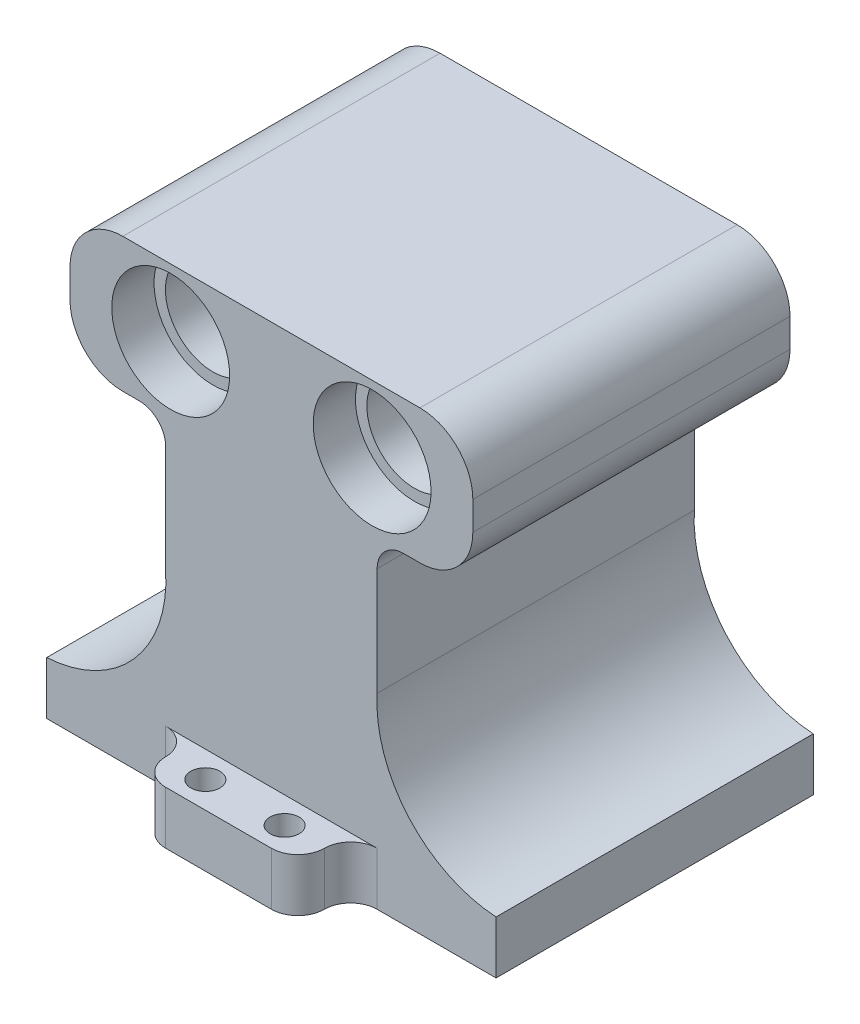
from build123d import *

# Parameters (mm, degrees)
SKETCH1_W           = 15
SKETCH1_H           = 10
SKETCH1_R           = 2.75
SKETCH1_W_2         = 85
SKETCH1_H_2         = 60
BOSS_EXTRUDE1_DEPTH = 10
BOSS_EXTRUDE2_DEPTH = 70
CUT_EXTRUDE1_DEPTH  = 10
FILLET1_START       = -1
FILLET1_DEPTH       = 11
FILLET1_2_DEPTH     = 10
SKETCH5_R           = 9
BOSS_EXTRUDE3_DEPTH = 60
SKETCH6_R           = 11.15
CUT_EXTRUDE2_DEPTH  = 8
CUT_EXTRUDE3_START  = -8
SKETCH7_R           = 11.15
CUT_EXTRUDE3_DEPTH  = 8
FILLET2_R           = 10
FILLET3_R           = 5


with BuildPart() as part:
    # Sketch1 → Boss-Extrude1 (new body)
    # profile 1 of 5: a face of its own
    with BuildSketch(Plane(origin=(0, 0, 0), x_dir=(1, 0, 0), z_dir=(0, 1, 0))):
        with Locations((35, 65)):
            Rectangle(SKETCH1_W, SKETCH1_H)
        with Locations(Location((35, 65, 0), (0, 0, 270))):
            Circle(SKETCH1_R, mode=Mode.SUBTRACT)
    # profile 2 of 5: a face of its own
    with BuildSketch(Plane(origin=(0, 0, 0), x_dir=(1, 0, 0), z_dir=(0, 1, 0))):
        with Locations((50, 65)):
            Rectangle(SKETCH1_W, SKETCH1_H)
        with Locations(Location((50, 65, 0), (0, 0, 270))):
            Circle(SKETCH1_R, mode=Mode.SUBTRACT)
    # profile 3 of 5: a face of its own
    with BuildSketch(Plane(origin=(0, 0, 0), x_dir=(1, 0, 0), z_dir=(0, 1, 0))):
        with Locations((50, -5)):
            Rectangle(SKETCH1_W, SKETCH1_H)
        with Locations(Location((50, -5, 0), (0, 0, 270))):
            Circle(SKETCH1_R, mode=Mode.SUBTRACT)
    # profile 4 of 5: a face of its own
    with BuildSketch(Plane(origin=(0, 0, 0), x_dir=(1, 0, 0), z_dir=(0, 1, 0))):
        with Locations((35, -5)):
            Rectangle(SKETCH1_W, SKETCH1_H)
        with Locations(Location((35, -5, 0), (0, 0, 270))):
            Circle(SKETCH1_R, mode=Mode.SUBTRACT)
    # profile 5 of 5: a face of its own
    with BuildSketch(Plane(origin=(0, 0, 0), x_dir=(1, 0, 0), z_dir=(0, 1, 0))):
        with Locations((42.5, 30)):
            Rectangle(SKETCH1_W_2, SKETCH1_H_2)
    extrude(amount=BOSS_EXTRUDE1_DEPTH)

    # Sketch4 → Boss-Extrude2 (add)
    with BuildSketch(Plane(origin=(0, 0, -70), x_dir=(-1, 0, 0), z_dir=(0, 0, -1))):
        with BuildLine():
            Line((-85, 10), (-62.5, 10))
            Line((-62.5, 10), (-62.5, 32.5))
            ThreePointArc((-62.5, 32.5), (-69.483783569, 16.983783569), (-85, 10))
        make_face()
        with BuildLine():
            Line((-57.5, 10), (-42.5, 10))
            Line((-42.5, 10), (-42.5, 60.8))
            Line((-42.5, 60.8), (-62.5, 60.8))
            Line((-62.5, 60.8), (-62.5, 35.4))
            ThreePointArc((-62.5, 35.4), (-62.45614662, 33.95), (-62.5, 32.5))
            Line((-62.5, 32.5), (-62.5, 10))
            Line((-62.5, 10), (-57.5, 10))
        make_face()
        with BuildLine():
            Line((-42.5, 60.8), (-42.5, 10))
            Line((-42.5, 10), (-27.5, 10))
            Line((-27.5, 10), (-22.5, 10))
            Line((-22.5, 10), (-22.5, 32.5))
            ThreePointArc((-22.5, 32.5), (-22.54385338, 33.95), (-22.5, 35.4))
            Line((-22.5, 35.4), (-22.5, 60.8))
            Line((-22.5, 60.8), (-42.5, 60.8))
        make_face()
        with BuildLine():
            Line((-22.5, 32.5), (-22.5, 10))
            Line((-22.5, 10), (0, 10))
            ThreePointArc((0, 10), (-15.516216431, 16.983783569), (-22.5, 32.5))
        make_face()
    extrude(amount=-BOSS_EXTRUDE2_DEPTH)

    # Sketch4<4> → Cut-Extrude1 (cut)
    with BuildSketch(Plane(origin=(0, 0, -70), x_dir=(-1, 0, 0), z_dir=(0, 0, -1))):
        with BuildLine():
            Line((-57.5, 10), (-42.5, 10))
            Line((-42.5, 10), (-42.5, 60.8))
            Line((-42.5, 60.8), (-62.5, 60.8))
            Line((-62.5, 60.8), (-62.5, 35.4))
            ThreePointArc((-62.5, 35.4), (-62.45614662, 33.95), (-62.5, 32.5))
            Line((-62.5, 32.5), (-62.5, 10))
            Line((-62.5, 10), (-57.5, 10))
        make_face()
        with BuildLine():
            Line((-42.5, 60.8), (-42.5, 10))
            Line((-42.5, 10), (-27.5, 10))
            Line((-27.5, 10), (-22.5, 10))
            Line((-22.5, 10), (-22.5, 32.5))
            ThreePointArc((-22.5, 32.5), (-22.54385338, 33.95), (-22.5, 35.4))
            Line((-22.5, 35.4), (-22.5, 60.8))
            Line((-22.5, 60.8), (-42.5, 60.8))
        make_face()
        with BuildLine():
            Line((-85, 10), (-62.5, 10))
            Line((-62.5, 10), (-62.5, 32.5))
            ThreePointArc((-62.5, 32.5), (-69.483783569, 16.983783569), (-85, 10))
        make_face()
        with BuildLine():
            Line((-22.5, 32.5), (-22.5, 10))
            Line((-22.5, 10), (0, 10))
            ThreePointArc((0, 10), (-15.516216431, 16.983783569), (-22.5, 32.5))
        make_face()
    extrude(amount=-CUT_EXTRUDE1_DEPTH, mode=Mode.SUBTRACT)

    # Fillet1: read off the stored shape, not the designer's step
    # Fillet1 outline → Fillet1 (cut)
    with BuildSketch(Plane(origin=(0, 0, 0), x_dir=(1, 0, 0), z_dir=(0, 1, 0)).offset(FILLET1_START)):
        with BuildLine():
            Line((27.5, 70), (27.5, 65))
            ThreePointArc((27.5, 65), (28.964466094, 68.535533906), (32.5, 70))
            Line((32.5, 70), (27.5, 70))
        make_face()
        with BuildLine():
            Line((57.5, 70), (52.5, 70))
            ThreePointArc((52.5, 70), (56.035533906, 68.535533906), (57.5, 65))
            Line((57.5, 65), (57.5, 70))
        make_face()
        with BuildLine():
            Line((57.5, -10), (57.5, -5))
            ThreePointArc((57.5, -5), (56.035533906, -8.535533906), (52.5, -10))
            Line((52.5, -10), (57.5, -10))
        make_face()
        with BuildLine():
            Line((27.5, -10), (32.5, -10))
            ThreePointArc((32.5, -10), (28.964466094, -8.535533906), (27.5, -5))
            Line((27.5, -5), (27.5, -10))
        make_face()
    extrude(amount=FILLET1_DEPTH, mode=Mode.SUBTRACT)

    # Fillet1 2 outline → Fillet1 2 (add)
    with BuildSketch(Plane(origin=(0, 0, 0), x_dir=(1, 0, 0), z_dir=(0, 1, 0))):
        with BuildLine():
            ThreePointArc((27.5, 65), (26.035533906, 61.464466094), (22.5, 60))
            Line((22.5, 60), (27.5, 60))
            Line((27.5, 60), (27.5, 65))
        make_face()
        with BuildLine():
            Line((57.5, 65), (57.5, 60))
            Line((57.5, 60), (62.5, 60))
            ThreePointArc((62.5, 60), (58.964466094, 61.464466094), (57.5, 65))
        make_face()
        with BuildLine():
            Line((57.5, 0), (57.5, -5))
            ThreePointArc((57.5, -5), (58.964466094, -1.464466094), (62.5, 0))
            Line((62.5, 0), (57.5, 0))
        make_face()
        with BuildLine():
            Line((27.5, -5), (27.5, 0))
            Line((27.5, 0), (22.5, 0))
            ThreePointArc((22.5, 0), (26.035533906, -1.464466094), (27.5, -5))
        make_face()
    extrude(amount=FILLET1_2_DEPTH)

    # Sketch5 → Boss-Extrude3 (add)
    # profile 1 of 2: a face of its own
    with BuildSketch(Plane.XY):
        Polygon((22.5, 60.8), (42.5, 60.8), (42.5, 86.2), (4.4, 86.2), (4.4, 60.8), align=None)
        with Locations((23.45, 73.5)):
            Circle(SKETCH5_R, mode=Mode.SUBTRACT)
    # profile 2 of 2: a face of its own
    with BuildSketch(Plane.XY):
        Polygon((42.5, 86.2), (42.5, 60.8), (62.5, 60.8), (80.6, 60.8), (80.6, 86.2), align=None)
        with Locations((61.55, 73.5)):
            Circle(SKETCH5_R, mode=Mode.SUBTRACT)
    extrude(amount=-BOSS_EXTRUDE3_DEPTH)

    # Sketch6 → Cut-Extrude2 (cut)
    with BuildSketch(Plane.XY):
        with Locations((23.45, 73.5)):
            Circle(SKETCH6_R)
        with Locations((61.55, 73.5)):
            Circle(SKETCH6_R)
    extrude(amount=-CUT_EXTRUDE2_DEPTH, mode=Mode.SUBTRACT)

    # Sketch7 → Cut-Extrude3 (cut)
    with BuildSketch(Plane(origin=(0, 0, -60), x_dir=(-1, 0, 0), z_dir=(0, 0, -1)).offset(CUT_EXTRUDE3_START)):
        with Locations(Location((-61.55, 73.5, 0), (0, 0, 180))):
            Circle(SKETCH7_R)
        with Locations(Location((-23.45, 73.5, 0), (0, 0, 180))):
            Circle(SKETCH7_R)
    extrude(amount=CUT_EXTRUDE3_DEPTH, mode=Mode.SUBTRACT)

    # Fillet2
    fillet2_edges = [part.edges().sort_by_distance(p)[0] for p in [
        (80.6, 60.8, -30),
        (4.4, 60.8, -30),
        (4.4, 86.2, -30),
        (80.6, 86.2, -30),
    ]]
    fillet(fillet2_edges, radius=FILLET2_R)

    # Fillet3
    fillet3_edges = [part.edges().sort_by_distance(p)[0] for p in [
        (62.5, 60.8, -30),
        (22.5, 60.8, -30),
    ]]
    fillet(fillet3_edges, radius=FILLET3_R)


solid = part.part
